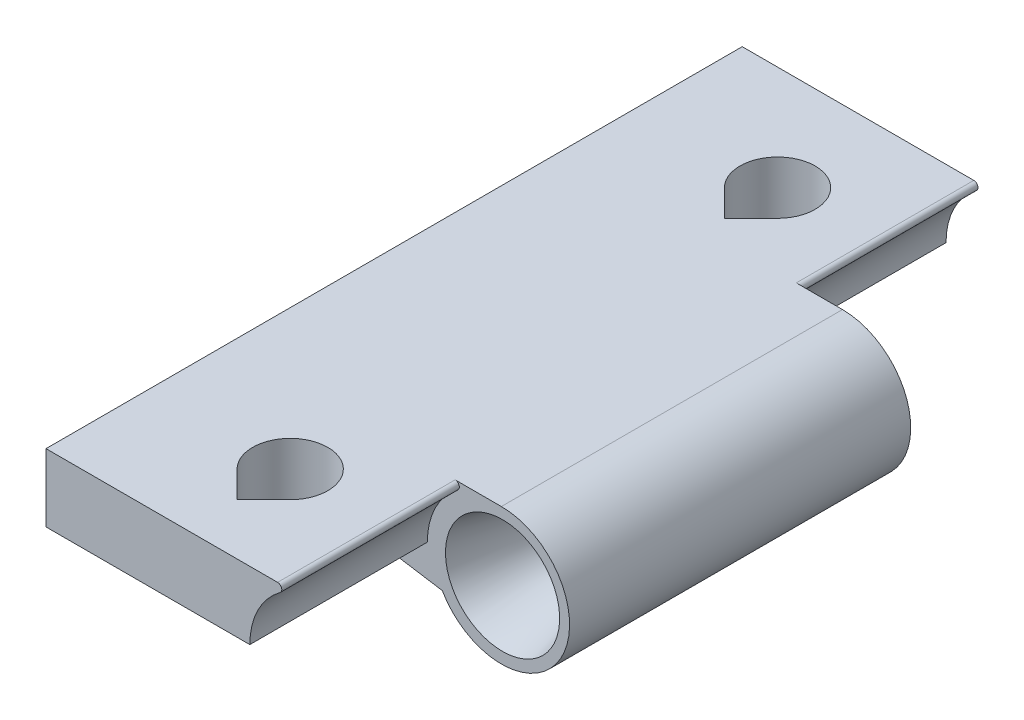
from build123d import *

# Parameters (mm, degrees)
BOSS_EXTRUDE1_DEPTH = 12.75
BOSS_EXTRUDE2_DEPTH = 24.5
BOSS_EXTRUDE3_DEPTH = 12.75
CUT_EXTRUDE1_DEPTH  = 34.504705063
CUT_EXTRUDE2_DEPTH  = 34.504705063


with BuildPart() as part:
    # Sketch1 → Boss-Extrude1 (new body)
    with BuildSketch(Plane(origin=(0, 0, -25), x_dir=(-1, 0, 0), z_dir=(0, 0, -1))):
        with BuildLine():
            Line((5.4, 0), (20.038095252, 0))
            Line((20.038095252, 0), (20.038095252, 4.871341922))
            Line((20.038095252, 4.871341922), (3.404824963, 4.871341922))
            ThreePointArc((3.404824963, 4.871341922), (3.120062709, 4.665737147), (3.225623649, 4.330744979))
            ThreePointArc((3.225623649, 4.330744979), (4.825886846, 2.422976712), (5.4, 0))
        make_face()
    extrude(amount=-BOSS_EXTRUDE1_DEPTH)

    # Sketch2 → Boss-Extrude2 (add)
    with BuildSketch(Plane.XY.offset(-12.25)):
        with BuildLine():
            Line((-20.038095252, 4.871341922), (-0.08660254, 4.871341922))
            ThreePointArc((-0.08660254, 4.871341922), (4.156921938, -2.478658078), (-4.330127019, -2.478658078))
            Line((-4.330127019, -2.478658078), (-20.038095252, 0.021341922))
            Line((-20.038095252, 0.021341922), (-20.038095252, 4.871341922))
        make_face()
    extrude(amount=BOSS_EXTRUDE2_DEPTH)

    # Sketch3 → Boss-Extrude3 (add)
    with BuildSketch(Plane.XY.offset(12.25)):
        with BuildLine():
            Line((-20.038095252, 4.871341922), (-3.404824963, 4.871341922))
            ThreePointArc((-3.404824963, 4.871341922), (-3.120062709, 4.665737147), (-3.225623649, 4.330744979))
            ThreePointArc((-3.225623649, 4.330744979), (-4.825886846, 2.422976712), (-5.4, 0))
            Line((-5.4, 0), (-20.038095252, 0))
            Line((-20.038095252, 0), (-20.038095252, 4.871341922))
        make_face()
    extrude(amount=BOSS_EXTRUDE3_DEPTH)

    # Sketch4 → Cut-Extrude1 (cut, through all)
    with BuildSketch(Plane(origin=(0, 4.871341922, 0), x_dir=(-1, 0, 0), z_dir=(0, 1, 0))):
        with BuildLine():
            Line((10, -13.681623382), (8.090811691, -15.590811691))
            ThreePointArc((8.090811691, -15.590811691), (10, -20.2), (11.909188309, -15.590811691))
            Line((11.909188309, -15.590811691), (10, -13.681623382))
        make_face()
    extrude(amount=-CUT_EXTRUDE1_DEPTH, mode=Mode.SUBTRACT)

    # Sketch5 → Cut-Extrude2 (cut, through all)
    with BuildSketch(Plane(origin=(0, 4.871341922, 0), x_dir=(-1, 0, 0), z_dir=(0, 1, 0))):
        with BuildLine():
            Line((10, 21.318376618), (8.090811691, 19.409188309))
            ThreePointArc((8.090811691, 19.409188309), (10, 14.8), (11.909188309, 19.409188309))
            Line((11.909188309, 19.409188309), (10, 21.318376618))
        make_face()
    extrude(amount=-CUT_EXTRUDE2_DEPTH, mode=Mode.SUBTRACT)

    # Sketch6 → Cut-Revolve1 (revolve, cut)
    with BuildSketch(Plane.XZ):
        with BuildLine():
            Line((4.1, 12.25), (0, 12.25))
            Line((0, 12.25), (0, -12.25))
            Line((0, -12.25), (4.182916362, -12.25))
            ThreePointArc((4.182916362, -12.25), (2.257265667, -0.006376751), (4.1, 12.25))
        make_face()
    revolve(axis=Axis((0, 0, 12.25), (0, 0, -1)), mode=Mode.SUBTRACT)


solid = part.part
